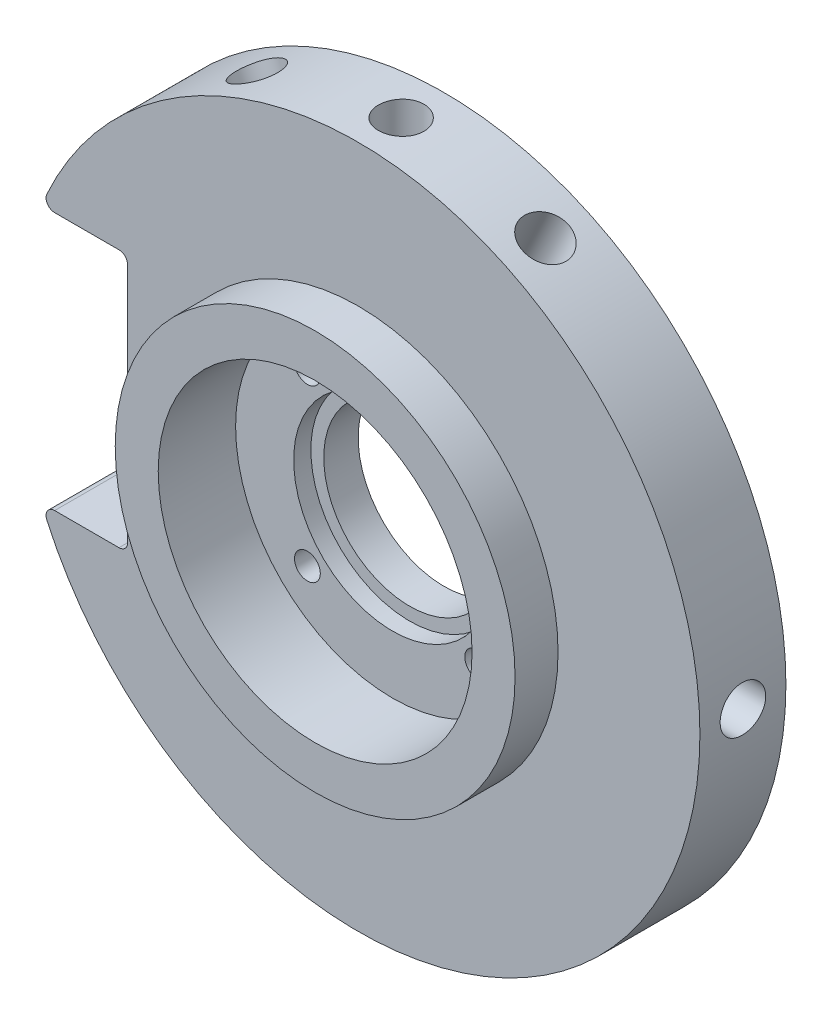
from build123d import *

# Parameters (mm, degrees)
SKETCH_1_R               = 39.75
EXTRUDE_1_DEPTH          = 10
SKETCH_2_R               = 18.25
CUT_EXTRUDE_1_DEPTH      = 4
SKETCH_3_R               = 11.5
CUT_EXTRUDE_2_DEPTH      = 2
SKETCH_4_R               = 1.5
CUT_EXTRUDE_3_DEPTH      = 6
SKETCH_5_R               = 3
CUT_EXTRUDE_4_DEPTH      = 2
SKETCH_7_R               = 2.65
CUT_EXTRUDE_5_DEPTH      = 8
PATTERN_CIRCULAR_1_COUNT = 2
PATTERN_CIRCULAR_1_ANGLE = 25
F_1_THE_OTHER_WAY_COUNT  = 2
F_1_THE_OTHER_WAY_ANGLE  = 25
MIRROR_1_COPY_1_SKETCH_R = 2.65
MIRROR_1_COPY_1_DEPTH    = 8
MIRROR_1_COPY_2_SKETCH_R = 2.65
MIRROR_1_COPY_2_DEPTH    = 8
SKETCH_8_R               = 10
CUT_EXTRUDE_6_DEPTH      = 4
SKETCH_9_R               = 2.65
CUT_EXTRUDE_7_DEPTH      = 8
PATTERN_CIRCULAR_2_COUNT = 2
EXTRUDE_START            = 5
SKETCH_10_R              = 23.25
SKETCH_10_R_2            = 18.25
EXTRUDE_2_DEPTH          = 5
CUT_EXTRUDE_START        = -10
CUT_EXTRUDE_8_DEPTH      = 10
FILLET_1_R               = 1


# Read off the part's stored shape, not the designer's step: Вырез-Вытянуть8
with BuildPart() as part:
    # Эскиз1 → Бобышка-Вытянуть1 (new body)
    with BuildSketch(Plane.XY):
        Circle(SKETCH_1_R)
    extrude(amount=EXTRUDE_1_DEPTH)

    # Эскиз2 → Вырез-Вытянуть1 (cut)
    with BuildSketch(Plane.XY.offset(10)):
        Circle(SKETCH_2_R)
    extrude(amount=-CUT_EXTRUDE_1_DEPTH, mode=Mode.SUBTRACT)

    # Эскиз3 → Вырез-Вытянуть2 (cut)
    with BuildSketch(Plane.XY.offset(6)):
        Circle(SKETCH_3_R)
    extrude(amount=-CUT_EXTRUDE_2_DEPTH, mode=Mode.SUBTRACT)

    # Эскиз4 → Вырез-Вытянуть3 (cut)
    with BuildSketch(Plane.XY.offset(6)):
        with Locations((-9.899494937, 9.899494937)):
            Circle(SKETCH_4_R)
        with Locations((9.899494937, 9.899494937)):
            Circle(SKETCH_4_R)
        with Locations((9.899494937, -9.899494937)):
            Circle(SKETCH_4_R)
        with Locations((-9.899494937, -9.899494937)):
            Circle(SKETCH_4_R)
    extrude(amount=-CUT_EXTRUDE_3_DEPTH, mode=Mode.SUBTRACT)

    # Эскиз5 → Вырез-Вытянуть4 (cut)
    with BuildSketch(Plane(origin=(0, 0, 0), x_dir=(-1, 0, 0), z_dir=(0, 0, -1))):
        with Locations((-9.899494937, 9.899494937)):
            Circle(SKETCH_5_R)
        with Locations((9.899494937, 9.899494937)):
            Circle(SKETCH_5_R)
        with Locations((9.899494937, -9.899494937)):
            Circle(SKETCH_5_R)
        with Locations((-9.899494937, -9.899494937)):
            Circle(SKETCH_5_R)
    extrude(amount=-CUT_EXTRUDE_4_DEPTH, mode=Mode.SUBTRACT)

    # Эскиз7 → Вырез-Вытянуть5 (cut)
    with BuildSketch(Plane(origin=(0, 39.75, 0), x_dir=(0, 0, -1), z_dir=(0, 1, 0))):
        with Locations(Location((-5, 0, 0), (0, 0, 90))):
            Circle(SKETCH_7_R)
    cut_extrude_5 = extrude(amount=-CUT_EXTRUDE_5_DEPTH, mode=Mode.SUBTRACT)

    # Круговой массив1: Вырез-Вытянуть5 ×2 about axis
    pattern_circular_1_axis = Axis((0, 0, 10), (0, 0, -1))
    for i in range(1, PATTERN_CIRCULAR_1_COUNT):
        add(cut_extrude_5.rotate(pattern_circular_1_axis, i * PATTERN_CIRCULAR_1_ANGLE / (PATTERN_CIRCULAR_1_COUNT - 1)), mode=Mode.SUBTRACT)

    # 1 the other way: Вырез-Вытянуть5 ×2 about axis
    f_1_the_other_way_axis = Axis((0, 0, 10), (0, 0, 1))
    for i in range(1, F_1_THE_OTHER_WAY_COUNT):
        add(cut_extrude_5.rotate(f_1_the_other_way_axis, i * F_1_THE_OTHER_WAY_ANGLE / (F_1_THE_OTHER_WAY_COUNT - 1)), mode=Mode.SUBTRACT)

    # Зеркальное отражение1: Вырез-Вытянуть5 across plane
    add(cut_extrude_5.mirror(Plane.ZX), mode=Mode.SUBTRACT)

    # Зеркальное отражение1 copy 1 sketch → Зеркальное отражение1 copy 1 (cut)
    with BuildSketch(Plane(origin=(16.799075904, -36.025734535, 0), x_dir=(0, 0, -1), z_dir=(0.4226182617407035, -0.906307787036648, 0))):
        with Locations((-5, 0)):
            Circle(MIRROR_1_COPY_1_SKETCH_R)
    extrude(amount=-MIRROR_1_COPY_1_DEPTH, mode=Mode.SUBTRACT)

    # Зеркальное отражение1 copy 2 sketch → Зеркальное отражение1 copy 2 (cut)
    with BuildSketch(Plane(origin=(-16.799075904, -36.025734535, 0), x_dir=(0, 0, -1), z_dir=(-0.42261826174069717, -0.9063077870366509, 0))):
        with Locations((-5, 0)):
            Circle(MIRROR_1_COPY_2_SKETCH_R)
    extrude(amount=-MIRROR_1_COPY_2_DEPTH, mode=Mode.SUBTRACT)

    # Эскиз8 → Вырез-Вытянуть6 (cut)
    with BuildSketch(Plane.XY.offset(4)):
        Circle(SKETCH_8_R)
    extrude(amount=-CUT_EXTRUDE_6_DEPTH, mode=Mode.SUBTRACT)

    # Эскиз9 → Вырез-Вытянуть7 (cut)
    with BuildSketch(Plane.ZY.offset(39.75)):
        with Locations((5, 0)):
            Circle(SKETCH_9_R)
    cut_extrude_7 = extrude(amount=-CUT_EXTRUDE_7_DEPTH, mode=Mode.SUBTRACT)

    # Круговой массив2: Вырез-Вытянуть7 ×2 about axis
    pattern_circular_2_axis = Axis((0, 0, 10), (0, 0, -1))
    for i in range(1, PATTERN_CIRCULAR_2_COUNT):
        add(cut_extrude_7.rotate(pattern_circular_2_axis, i * 360 / PATTERN_CIRCULAR_2_COUNT), mode=Mode.SUBTRACT)

    # Эскиз10 → Бобышка-Вытянуть2 (add)
    with BuildSketch(Plane.XY.offset(10).offset(EXTRUDE_START)):
        Circle(SKETCH_10_R)
        Circle(SKETCH_10_R_2, mode=Mode.SUBTRACT)
    extrude(amount=-EXTRUDE_2_DEPTH)

    # Вырез-Вытянуть8 outline → Вырез-Вытянуть8 (cut)
    with BuildSketch(Plane(origin=(0, 0, 0), x_dir=(-1, 0, 0), z_dir=(0, 0, -1)).offset(CUT_EXTRUDE_START)):
        with BuildLine():
            Line((36.811173575, 15), (26.811173575, 15))
            Line((26.811173575, 15), (26.811173575, -15))
            Line((26.811173575, -15), (36.811173575, -15))
            ThreePointArc((36.811173575, -15), (39.75, 0), (36.811173575, 15))
        make_face()
    extrude(amount=CUT_EXTRUDE_8_DEPTH, mode=Mode.SUBTRACT)

    # Скругление1
    fillet_1_edges = [part.edges().sort_by_distance(p)[0] for p in [
        (-26.811173575, 15, 5),
        (-26.811173575, -15, 5),
        (-36.811173575, -15, 5),
        (-36.811173575, 15, 5),
    ]]
    fillet(fillet_1_edges, radius=FILLET_1_R)


solid = part.part
